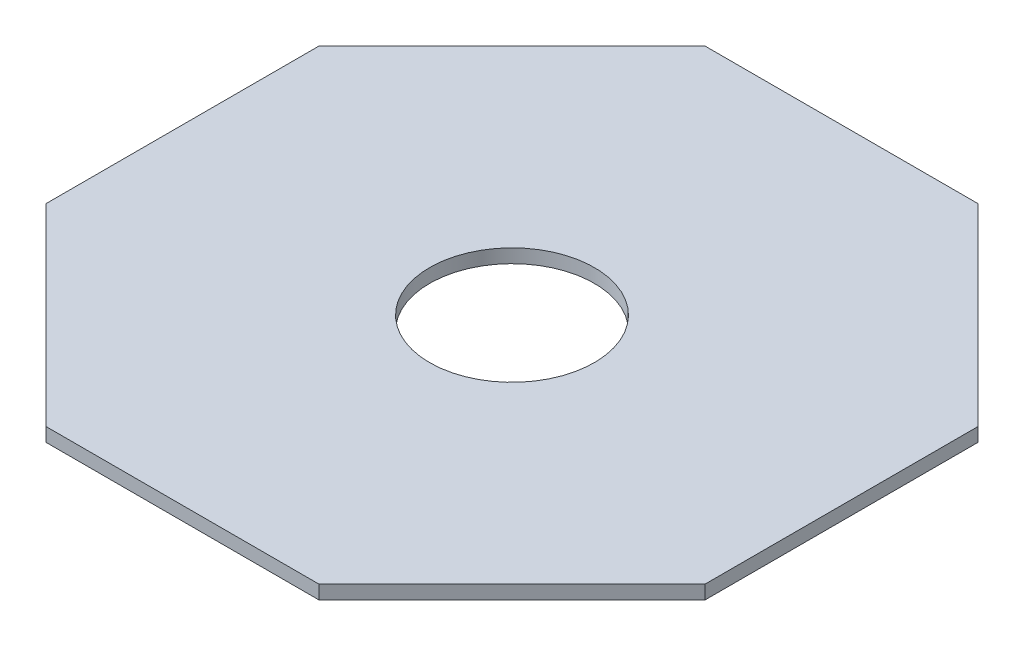
from build123d import *

# Parameters (mm, degrees)
BOSS_EXTRUDE1_DEPTH     = 6.35
CUT_EXTRUDE1_DEPTH      = 216.619670949
CUT_EXTRUDE1_DEPTH_BACK = 216.619670949
SKETCH2_R               = 38.1


with BuildPart() as part:
    # Sketch1 → Boss-Extrude1 (new body)
    with BuildSketch(Plane(origin=(0, 0, 0), x_dir=(1, 0, 0), z_dir=(0, 1, 0))):
        Polygon((63.126146906, 152.4), (-63.126146906, 152.4), (-152.4, 63.126146906), (-152.4, -63.126146906), (-63.126146906, -152.4), (63.126146906, -152.4), (152.4, -63.126146906), (152.4, 63.126146906), align=None)
    extrude(amount=BOSS_EXTRUDE1_DEPTH)

    # Sketch2 → Cut-Extrude1 (cut, two sides: drawn at the far end of the back side and taken through both)
    with BuildSketch(Plane(origin=(0, 6.35, 0), x_dir=(1, 0, 0), z_dir=(0, 1, 0)).offset(-CUT_EXTRUDE1_DEPTH_BACK)):
        Circle(SKETCH2_R)
    extrude(amount=CUT_EXTRUDE1_DEPTH + CUT_EXTRUDE1_DEPTH_BACK, mode=Mode.SUBTRACT)


solid = part.part
